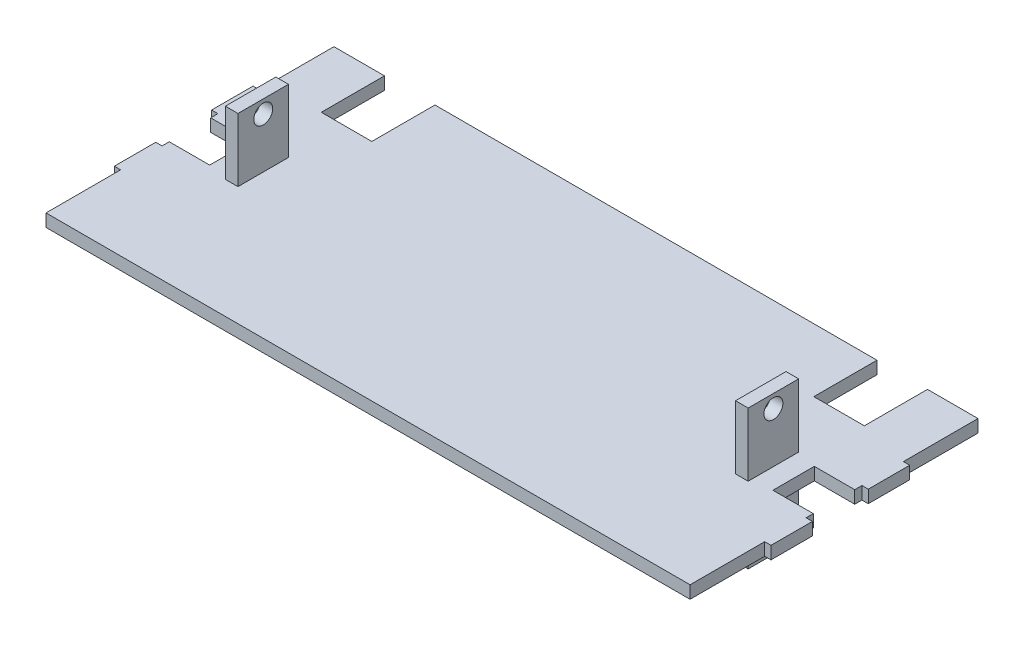
from build123d import *

# Parameters (mm, degrees)
BOSS_EXTRUDE1_DEPTH     = 3.175
SKETCH2_W               = 6.35
SKETCH2_H               = 25.4
BOSS_EXTRUDE2_DEPTH     = 35.052
CUT_EXTRUDE1_DEPTH      = 308.258672504
CUT_EXTRUDE1_DEPTH_BACK = 308.258672504
SKETCH3_R               = 4.7625


with BuildPart() as part:
    # Sketch1 → Boss-Extrude1 (new, symmetric)
    with BuildSketch(Plane(origin=(0, 0, 0), x_dir=(1, 0, 0), z_dir=(0, 1, 0))):
        Polygon((161.925, -72.39), (-161.925, -72.39), (-161.925, -34.874677354), (-165.1, -34.874677354), (-165.1, -14.046677354), (-161.925, -14.046677354), (-161.925, -10.414), (-141.605, -10.414), (-141.605, 10.414), (-161.925, 10.414), (-161.925, 14.046677354), (-165.1, 14.046677354), (-165.1, 34.874677354), (-161.925, 34.874677354), (-161.925, 72.39), (-136.525, 72.39), (-136.525, 40.64), (-111.125, 40.64), (-111.125, 72.39), (111.125, 72.39), (111.125, 40.64), (136.525, 40.64), (136.525, 72.39), (161.925, 72.39), (161.925, 34.874677354), (165.1, 34.874677354), (165.1, 14.046677354), (161.925, 14.046677354), (161.925, 10.414), (141.605, 10.414), (141.605, -10.414), (161.925, -10.414), (161.925, -14.046677354), (165.1, -14.046677354), (165.1, -34.874677354), (161.925, -34.874677354), align=None)
    extrude(amount=BOSS_EXTRUDE1_DEPTH, both=True)

    # Sketch2 → Boss-Extrude2 (add, symmetric)
    with BuildSketch(Plane(origin=(0, 0, 0), x_dir=(1, 0, 0), z_dir=(0, 1, 0))):
        with Locations((128.27, 0)):
            Rectangle(SKETCH2_W, SKETCH2_H)
        with Locations((-128.27, 0)):
            Rectangle(SKETCH2_W, SKETCH2_H)
    extrude(amount=BOSS_EXTRUDE2_DEPTH, both=True)

    # Sketch3 → Cut-Extrude1 (cut, two sides: drawn at the far end of the back side and taken through both)
    with BuildSketch(Plane.ZY.offset(131.445).offset(-CUT_EXTRUDE1_DEPTH_BACK)):
        with Locations((0, 28.440626924)):
            Circle(SKETCH3_R)
        with Locations((0, -28.440626924)):
            Circle(SKETCH3_R)
    extrude(amount=CUT_EXTRUDE1_DEPTH + CUT_EXTRUDE1_DEPTH_BACK, mode=Mode.SUBTRACT)


solid = part.part
